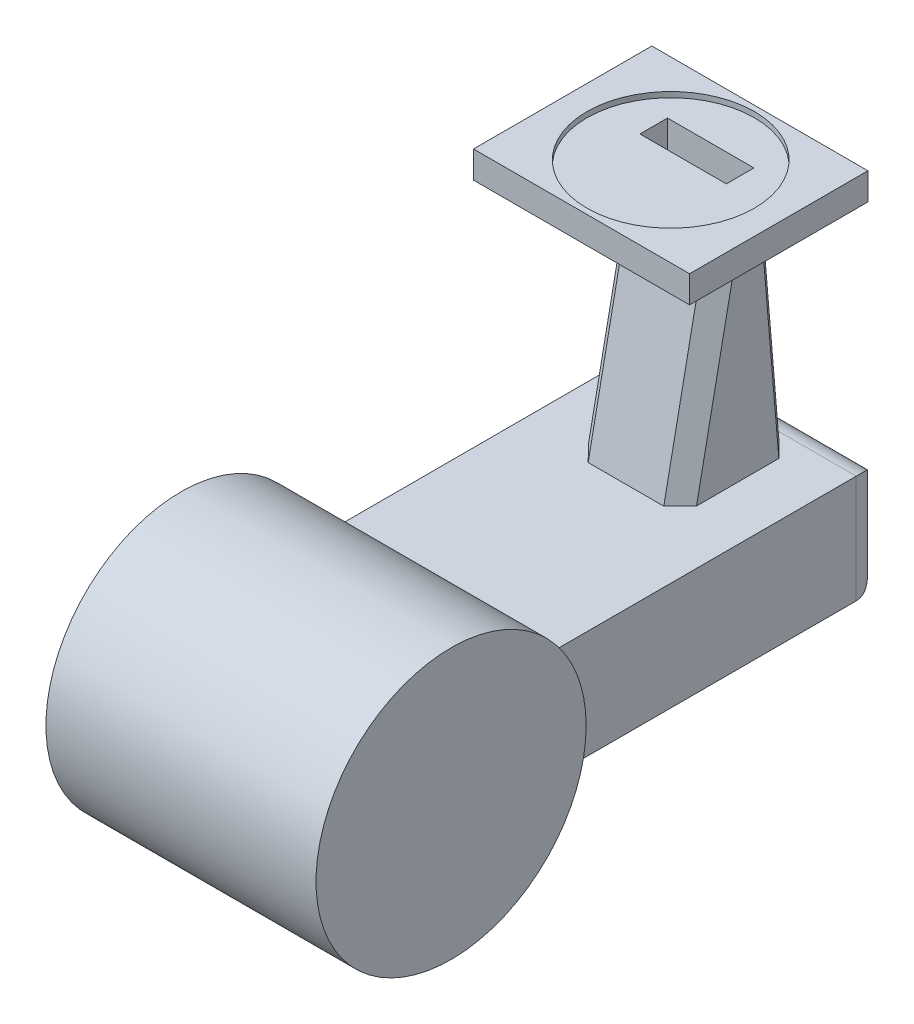
from build123d import *

# Parameters (mm, degrees)
BOSS_EXTRUDE1_DEPTH      = 25
BOSS_EXTRUDE1_DEPTH_BACK = 25
SKETCH1_R                = 25
BOSS_EXTRUDE4_DEPTH      = 20
BOSS_EXTRUDE4_DEPTH_BACK = 20
SKETCH9_W                = 85
SKETCH9_H                = 20
SHELL3_START             = -18
SHELL3_DEPTH             = 36
SHELL3_START_2           = -23
SHELL3_2_OUTLINE_R       = 23
SHELL3_2_DEPTH           = 46
FILLET2_R                = 5
BOSS_EXTRUDE5_DEPTH      = 10
BOSS_EXTRUDE5_DEPTH_BACK = 10
SKETCH5_W                = 40
SKETCH5_H                = 33.01510515
BOSS_EXTRUDE3_DEPTH      = 5
CUT_EXTRUDE2_REACH       = 111.266
SKETCH8_R                = 7.5
SKETCH12_W               = 16
SKETCH12_H               = 5.10776434
CUT_EXTRUDE3_DEPTH       = 119.899470043
CHAMFER2_SIZE            = 3
SKETCH13_R               = 15.5
CUT_EXTRUDE4_DEPTH       = 1


# Read off the part's stored shape, not the designer's step: Shell3
with BuildPart() as part:
    # Sketch1 → Boss-Extrude1 (new, two sides: drawn at the far end of the back side and taken through both)
    with BuildSketch(Plane(origin=(0, 0, 0), x_dir=(0, 0, -1), z_dir=(1, 0, 0)).offset(-BOSS_EXTRUDE1_DEPTH_BACK)):
        with Locations((-56.501901141, -5)):
            Circle(SKETCH1_R)
    extrude(amount=BOSS_EXTRUDE1_DEPTH + BOSS_EXTRUDE1_DEPTH_BACK)

    # Sketch9 → Boss-Extrude4 (add, two sides: drawn at the far end of the back side and taken through both)
    with BuildSketch(Plane(origin=(0, 0, 0), x_dir=(0, 0, -1), z_dir=(1, 0, 0)).offset(-BOSS_EXTRUDE4_DEPTH_BACK)):
        with Locations((-14.001901141, -5)):
            Rectangle(SKETCH9_W, SKETCH9_H)
    extrude(amount=BOSS_EXTRUDE4_DEPTH + BOSS_EXTRUDE4_DEPTH_BACK)

    # Shell3 outline → Shell3 (cut)
    with BuildSketch(Plane.YZ.offset(SHELL3_START)):
        with BuildLine():
            ThreePointArc((3, 34.938042488), (-5, 79.501901141), (-13, 34.938042488))
            Line((-13, 34.938042488), (-13, -26.498098859))
            Line((-13, -26.498098859), (3, -26.498098859))
            Line((3, -26.498098859), (3, 34.938042488))
        make_face()
    extrude(amount=SHELL3_DEPTH, mode=Mode.SUBTRACT)

    # Shell3 2 outline → Shell3 2 (cut)
    with BuildSketch(Plane.YZ.offset(SHELL3_START_2)):
        with Locations((-5, 56.501901141)):
            Circle(SHELL3_2_OUTLINE_R)
    extrude(amount=SHELL3_2_DEPTH, mode=Mode.SUBTRACT)

    # Fillet2
    fillet2_edges = [part.edges().sort_by_distance(p)[0] for p in [
        (0, 5, -28.498098859),
        (-20, -5, -28.498098859),
        (0, -15, -28.498098859),
        (20, -5, -28.498098859),
    ]]
    fillet(fillet2_edges, radius=FILLET2_R)

    # Sketch11 → Boss-Extrude5 (add, two sides: drawn at the far end of the back side and taken through both)
    with BuildSketch(Plane.ZY.offset(-BOSS_EXTRUDE5_DEPTH_BACK)):
        Polygon((-0.876282257, 5), (-9.456060259, 47.882592183), (-18.563824599, 47.882592183), (-22.259728969, 4.059726083), align=None)
    extrude(amount=BOSS_EXTRUDE5_DEPTH + BOSS_EXTRUDE5_DEPTH_BACK)

    # Sketch5 → Boss-Extrude3 (add)
    with BuildSketch(Plane(origin=(0, 47.882592183, 0), x_dir=(1, 0, 0), z_dir=(0, 1, 0))):
        with Locations((0, 9.154141988)):
            Rectangle(SKETCH5_W, SKETCH5_H)
    extrude(amount=BOSS_EXTRUDE3_DEPTH)

    # Sketch8 → Cut-Extrude2 (cut, up to next)
    with BuildSketch(Plane.ZY.offset(25), mode=Mode.PRIVATE) as cut_extrude2_sk1:
        with Locations((56.501901141, -5)):
            Circle(SKETCH8_R)
    cut_extrude2_tool1 = extrude(cut_extrude2_sk1.sketch, amount=-CUT_EXTRUDE2_REACH, mode=Mode.PRIVATE) & part.part
    add(cut_extrude2_tool1.solids().sort_by_distance((-25, -5, 56.501901))[0], mode=Mode.SUBTRACT)

    # Sketch12 → Cut-Extrude3 (cut, through all)
    with BuildSketch(Plane(origin=(0, 52.882592183, 0), x_dir=(1, 0, 0), z_dir=(0, 1, 0))):
        with Locations((0, 14.009942429)):
            Rectangle(SKETCH12_W, SKETCH12_H)
    extrude(amount=-CUT_EXTRUDE3_DEPTH, mode=Mode.SUBTRACT)

    # Chamfer2
    chamfer2_edges = [part.edges().sort_by_distance(p)[0] for p in [
        (10, 26.441296092, -20.372126679),
        (10, 26.441296092, -5.166171258),
        (-10, 26.441296092, -5.166171258),
        (-10, 26.441296092, -20.372126679),
    ]]
    chamfer(chamfer2_edges, length=CHAMFER2_SIZE)

    # Sketch13 → Cut-Extrude4 (cut)
    with BuildSketch(Plane(origin=(0, 52.882592183, 0), x_dir=(1, 0, 0), z_dir=(0, 1, 0))):
        with Locations(Location((0, 9.154141988, 0), (0, 0, 270))):
            Circle(SKETCH13_R)
    extrude(amount=-CUT_EXTRUDE4_DEPTH, mode=Mode.SUBTRACT)


solid = part.part
